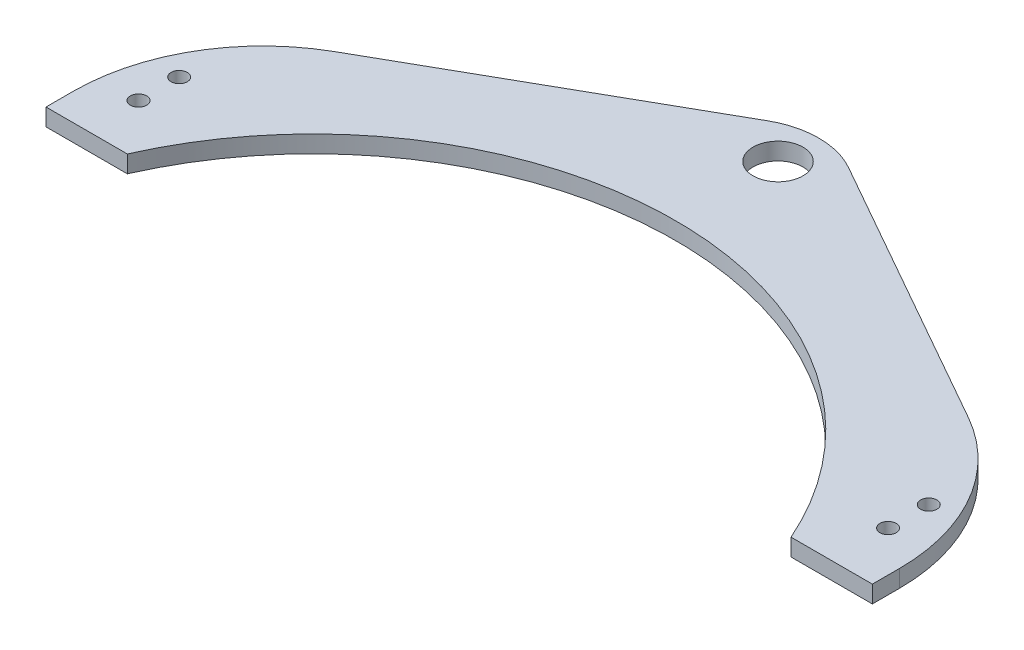
from build123d import *

# Parameters (mm, degrees)
SKETCH1_R           = 4.6
SKETCH1_R_2         = 1.5
BOSS_EXTRUDE2_DEPTH = 3.175


with BuildPart() as part:
    # Sketch1 → Boss-Extrude2 (new body)
    with BuildSketch(Plane(origin=(0, 0, 0), x_dir=(1, 0, 0), z_dir=(0, 1, 0))):
        with BuildLine():
            Line((-15, 0), (0, 0))
            ThreePointArc((0, 0), (61.2, 39.907584028), (122.4, 0))
            Line((122.4, 0), (129.9, 0))
            Line((129.9, 0), (137.4, 0))
            Line((137.4, 0), (137.4, 5.001196831))
            ThreePointArc((137.4, 5.001196831), (132.638976527, 22.625166265), (119.651182936, 35.45438529))
            Line((119.651182936, 35.45438529), (68.639886063, 64.351366482))
            ThreePointArc((68.639886063, 64.351366482), (65.069446402, 65.804662996), (61.246521948, 66.3))
            Line((61.246521948, 66.3), (61.153478052, 66.3))
            ThreePointArc((61.153478052, 66.3), (57.330553598, 65.804662996), (53.760113937, 64.351366482))
            Line((53.760113937, 64.351366482), (2.748817064, 35.45438529))
            ThreePointArc((2.748817064, 35.45438529), (-10.238976527, 22.625166265), (-15, 5.001196831))
            Line((-15, 5.001196831), (-15, 0))
        make_face()
        with Locations((61.2, 58.8)):
            Circle(SKETCH1_R, mode=Mode.SUBTRACT)
        with Locations((-7.5, 9.564345145)):
            Circle(SKETCH1_R_2, mode=Mode.SUBTRACT)
        with Locations((-7.5, 17.064345145)):
            Circle(SKETCH1_R_2, mode=Mode.SUBTRACT)
        with BuildLine():
            ThreePointArc((129.9, 8.9), (128.4, 10.4), (129.9, 11.9))
            ThreePointArc((129.9, 11.9), (131.4, 10.4), (129.9, 8.9))
        make_face(mode=Mode.SUBTRACT)
        with Locations((129.9, 17.9)):
            Circle(SKETCH1_R_2, mode=Mode.SUBTRACT)
    extrude(amount=BOSS_EXTRUDE2_DEPTH)


solid = part.part
